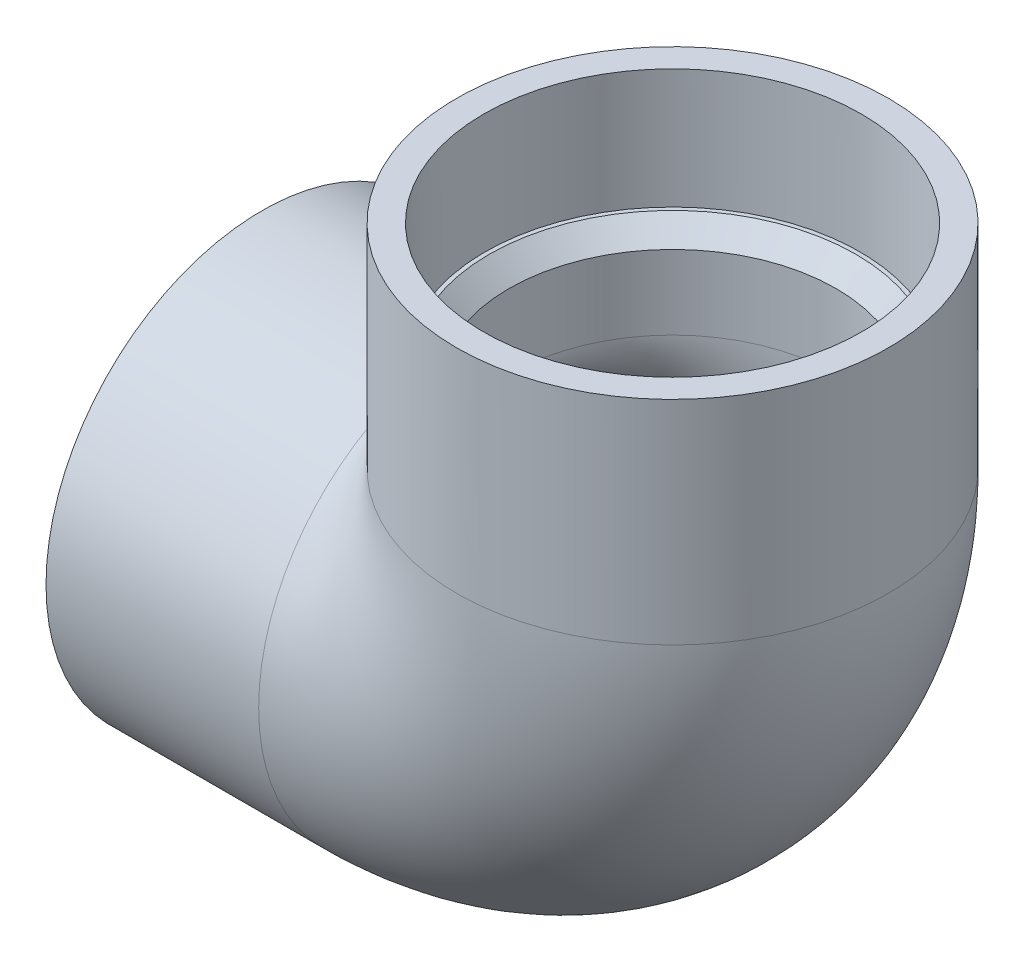
from build123d import *

# Parameters (mm, degrees)
SWEEP1_OUTLINE_R    = 26.2509
SWEEP1_ANGLE        = 90
SKETCH5_R           = 30.0863
SKETCH5_R_2         = 26.2509
BOSS_EXTRUDE1_DEPTH = 15.08125
SKETCH6_R           = 30.0863
SKETCH6_R_2         = 26.2509
BOSS_EXTRUDE2_DEPTH = 15.08125
CHAMFER1_SIZE       = 3.175


# Read off the part's stored shape, not the designer's step: Sweep1
with BuildPart() as part:
    # Sketch1 → Revolve1 (revolve)
    with BuildSketch(Plane.XY, mode=Mode.PRIVATE) as revolve1_sk:
        Polygon((-65.88125, -34.671), (-31.75, -34.671), (-31.75, -30.0863), (-65.88125, -30.3149), align=None)
    revolve(revolve1_sk.sketch.rotate(Axis((-65.88125, 0, 0), (1, 0, 0)), 270), axis=Axis((-65.88125, 0, 0), (1, 0, 0)))



with BuildPart() as body_2:
    # Sketch2 → Revolve2 (revolve)
    with BuildSketch(Plane.XY, mode=Mode.PRIVATE) as revolve2_sk:
        Polygon((30.3149, 65.88125), (30.0863, 31.75), (34.671, 31.75), (34.671, 65.88125), align=None)
    revolve(revolve2_sk.sketch.rotate(Axis((0, 0, 0), (0, 1, 0)), 90), axis=Axis((0, 0, 0), (0, 1, 0)))


with BuildPart() as part_1:
    add(part.part)

    add(body_2.part)  # Sweep1 merges body 2
    # Sweep1 outline → Sweep1 (revolve)
    with BuildSketch(Plane(origin=(-31.75, 31.75, 0), x_dir=(0, -1, 0), z_dir=(-1, 0, 0))):
        with BuildLine():
            add(Edge.make_bspline(
                [(0, -13.928953335), (2.758801491, -20.217433541), (7.44939065, -26.654028805), (14.510622057, -32.115497619), (23.372014259, -34.671000063), (36.723995235, -34.670999963), (41.590780957, -33.77866256), (46.012614581, -32.074973917), (49.828647812, -29.864061232), (57.363975529, -23.998855236), (61.444295145, -19.453456243), (64.75914011, -13.597876192), (68.073475891, 2.89e-07), (64.759139858, 13.597876639), (61.444294937, 19.453456476), (57.363975419, 23.998855322), (49.828647737, 29.864061291), (46.012614402, 32.07497402), (41.590780646, 33.778662679), (36.723994781, 34.671000046), (23.372013776, 34.670999922), (14.510621759, 32.115497392), (7.449390517, 26.654028621), (2.758801453, 20.217433454), (0, 13.928953335)],
                knots=[7.870122559, 7.870122559, 7.870122559, 7.870122559, 7.870122559, 7.870122559, 9.011354719, 9.011354719, 9.011354719, 9.011354719, 9.688902167, 9.688902167, 9.688902167, 9.688902167, 10.598291982, 10.598291982, 10.598291982, 11.507681775, 11.507681775, 11.507681775, 11.507681775, 12.185229238, 12.185229238, 12.185229238, 12.185229238, 13.326461383, 13.326461383, 13.326461383, 13.326461383, 13.326461383, 13.326461383], degree=5, weights=[1, 1, 0.994496321, 0.990253974, 1, 1, 0.999597705, 1.000064238, 1, 1, 0.998946903, 0.997168626, 1.002831374, 0.997168626, 0.998946903, 1, 1, 1.000064238, 0.999597705, 1, 1, 0.990253974, 0.994496321, 1, 1]))
            Line((0, 13.928953335), (0, -13.928953335))
        make_face()
        with Locations((31.75, 0)):
            Circle(SWEEP1_OUTLINE_R, mode=Mode.SUBTRACT)
    revolve(axis=Axis((-31.75, 31.75, 0), (0, 0, 1)), revolution_arc=SWEEP1_ANGLE)

    # Sketch5 → Boss-Extrude1 (add)
    with BuildSketch(Plane.ZY.offset(31.75)):
        Circle(SKETCH5_R)
        with Locations(Location((0, 0, 0), (0, 0, 270))):
            Circle(SKETCH5_R_2, mode=Mode.SUBTRACT)
    extrude(amount=BOSS_EXTRUDE1_DEPTH)

    # Sketch6 → Boss-Extrude2 (add)
    with BuildSketch(Plane(origin=(0, 31.75, 0), x_dir=(1, 0, 0), z_dir=(0, 1, 0))):
        with Locations(Location((0, 0, 0), (0, 0, 270))):
            Circle(SKETCH6_R)
        Circle(SKETCH6_R_2, mode=Mode.SUBTRACT)
    extrude(amount=BOSS_EXTRUDE2_DEPTH)

    # Chamfer1
    chamfer1_edges = [part_1.edges().sort_by_distance(p)[0] for p in [
        (-46.83125, 26.2509, 0),
        (-26.2509, 46.83125, 0),
    ]]
    chamfer(chamfer1_edges, length=CHAMFER1_SIZE)


solid = part_1.part
